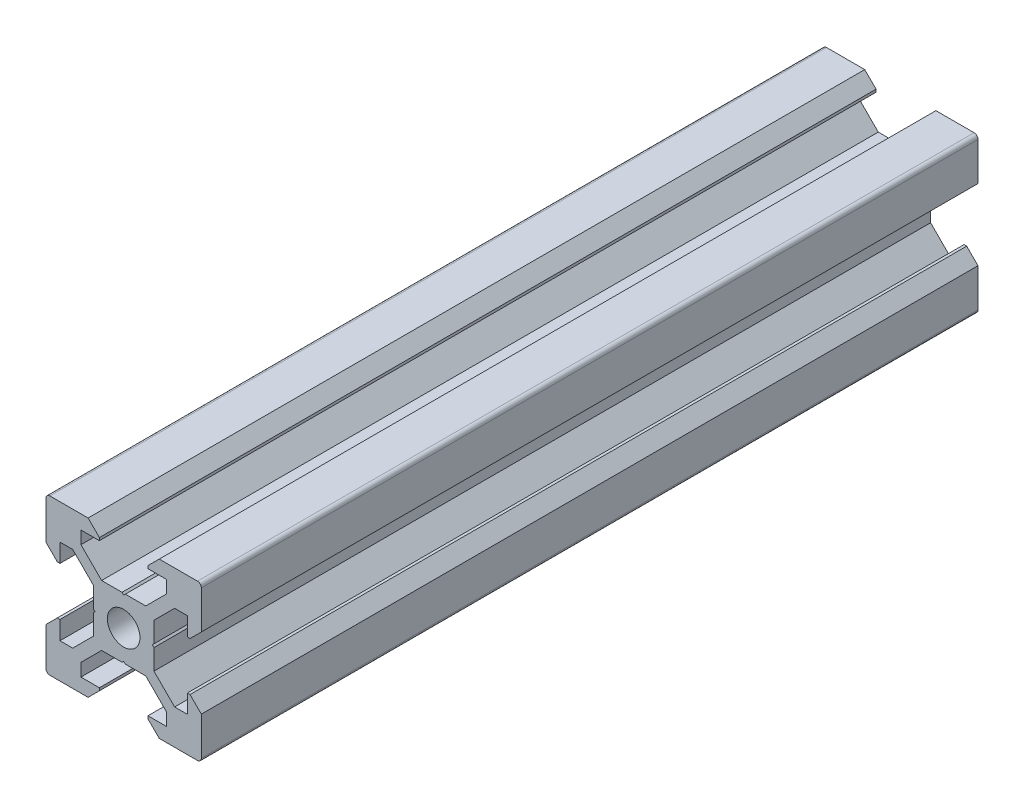
from build123d import *

# Parameters (mm, degrees)
SKETCH1_R           = 2.1
BOSS_EXTRUDE1_DEPTH = 50


with BuildPart() as part:
    # Sketch1 → Boss-Extrude1 (new, symmetric)
    with BuildSketch(Plane.XY):
        with BuildLine():
            Line((4.58, -10), (9.5, -10))
            ThreePointArc((9.5, -10), (9.853553391, -9.853553391), (10, -9.5))
            Line((10, -9.5), (10, -4.58))
            Line((10, -4.58), (8.545, -3.125))
            Line((8.545, -3.125), (8.2, -3.125))
            Line((8.2, -3.125), (8.2, -5.5))
            Line((8.2, -5.5), (6.560660172, -5.5))
            Line((6.560660172, -5.5), (3.9, -2.839339828))
            Line((3.9, -2.839339828), (3.9, -0.21))
            Line((3.9, -0.21), (3.69, 0))
            Line((3.69, 0), (3.9, 0.21))
            Line((3.9, 0.21), (3.9, 2.839339828))
            Line((3.9, 2.839339828), (6.560660172, 5.5))
            Line((6.560660172, 5.5), (8.2, 5.5))
            Line((8.2, 5.5), (8.2, 3.125))
            Line((8.2, 3.125), (8.545, 3.125))
            Line((8.545, 3.125), (10, 4.58))
            Line((10, 4.58), (10, 9.5))
            ThreePointArc((10, 9.5), (9.853553391, 9.853553391), (9.5, 10))
            Line((9.5, 10), (4.58, 10))
            Line((4.58, 10), (3.125, 8.545))
            Line((3.125, 8.545), (3.125, 8.2))
            Line((3.125, 8.2), (5.5, 8.2))
            Line((5.5, 8.2), (5.5, 6.560660172))
            Line((5.5, 6.560660172), (2.839339828, 3.9))
            Line((2.839339828, 3.9), (0.21, 3.9))
            Line((0.21, 3.9), (0, 3.69))
            Line((0, 3.69), (-0.21, 3.9))
            Line((-0.21, 3.9), (-2.839339828, 3.9))
            Line((-2.839339828, 3.9), (-5.5, 6.560660172))
            Line((-5.5, 6.560660172), (-5.5, 8.2))
            Line((-5.5, 8.2), (-3.125, 8.2))
            Line((-3.125, 8.2), (-3.125, 8.545))
            Line((-3.125, 8.545), (-4.58, 10))
            Line((-4.58, 10), (-9.5, 10))
            ThreePointArc((-9.5, 10), (-9.853553391, 9.853553391), (-10, 9.5))
            Line((-10, 9.5), (-10, 4.58))
            Line((-10, 4.58), (-8.545, 3.125))
            Line((-8.545, 3.125), (-8.2, 3.125))
            Line((-8.2, 3.125), (-8.2, 5.5))
            Line((-8.2, 5.5), (-6.560660172, 5.5))
            Line((-6.560660172, 5.5), (-3.9, 2.839339828))
            Line((-3.9, 2.839339828), (-3.9, 0.21))
            Line((-3.9, 0.21), (-3.69, 0))
            Line((-3.69, 0), (-3.9, -0.21))
            Line((-3.9, -0.21), (-3.9, -2.839339828))
            Line((-3.9, -2.839339828), (-6.560660172, -5.5))
            Line((-6.560660172, -5.5), (-8.2, -5.5))
            Line((-8.2, -5.5), (-8.2, -3.125))
            Line((-8.2, -3.125), (-8.545, -3.125))
            Line((-8.545, -3.125), (-10, -4.58))
            Line((-10, -4.58), (-10, -9.5))
            ThreePointArc((-10, -9.5), (-9.853553391, -9.853553391), (-9.5, -10))
            Line((-9.5, -10), (-4.58, -10))
            Line((-4.58, -10), (-3.125, -8.545))
            Line((-3.125, -8.545), (-3.125, -8.2))
            Line((-3.125, -8.2), (-5.5, -8.2))
            Line((-5.5, -8.2), (-5.5, -6.560660172))
            Line((-5.5, -6.560660172), (-2.839339828, -3.9))
            Line((-2.839339828, -3.9), (-0.21, -3.9))
            Line((-0.21, -3.9), (0, -3.69))
            Line((0, -3.69), (0.21, -3.9))
            Line((0.21, -3.9), (2.839339828, -3.9))
            Line((2.839339828, -3.9), (5.5, -6.560660172))
            Line((5.5, -6.560660172), (5.5, -8.2))
            Line((5.5, -8.2), (3.125, -8.2))
            Line((3.125, -8.2), (3.125, -8.545))
            Line((3.125, -8.545), (4.58, -10))
        make_face()
        Circle(SKETCH1_R, mode=Mode.SUBTRACT)
    extrude(amount=BOSS_EXTRUDE1_DEPTH, both=True)


solid = part.part
